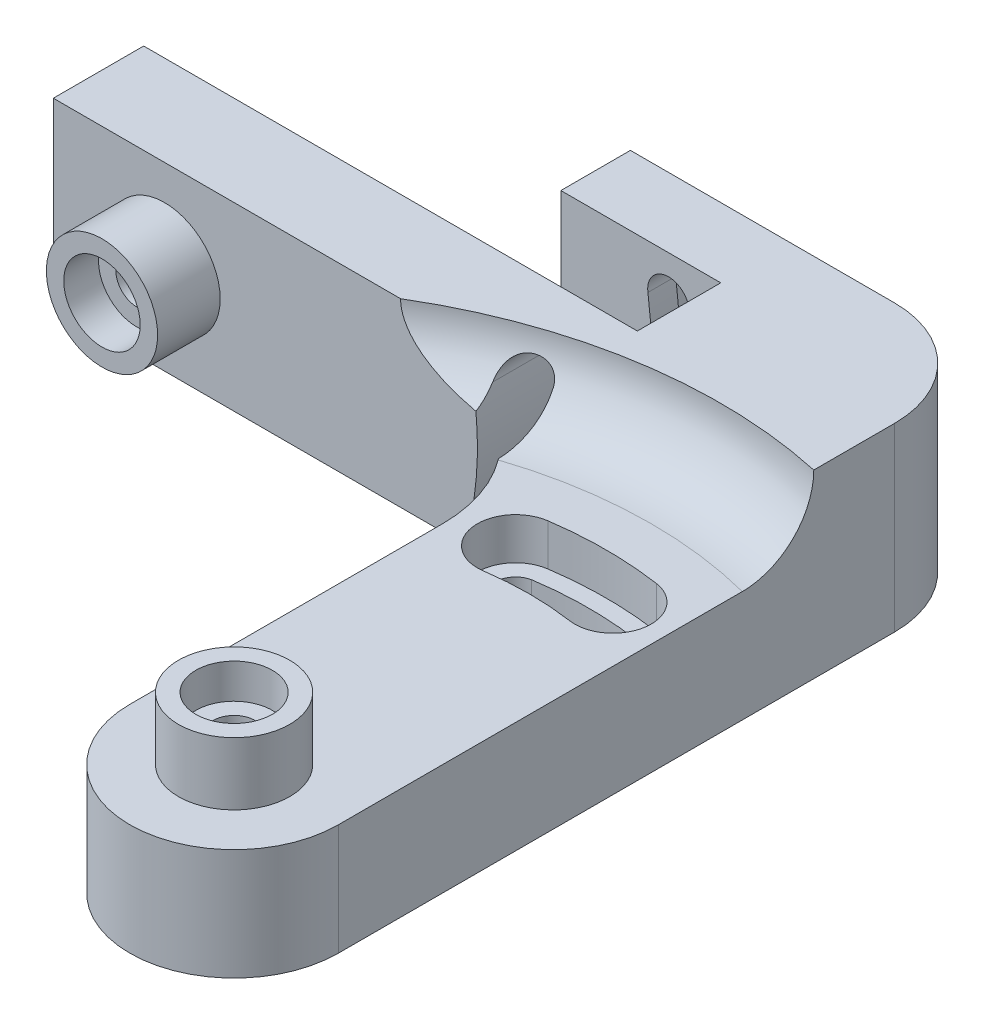
from build123d import *

# Parameters (mm, degrees)
SKETCH1_R           = 1.5
BOSS_EXTRUDE1_DEPTH = 8
SKETCH2_R           = 4
SKETCH2_R_2         = 1.5
BOSS_EXTRUDE2_DEPTH = 2
SKETCH4_R           = 4
SKETCH4_R_2         = 2.75
BOSS_EXTRUDE3_DEPTH = 2.5
CUT_EXTRUDE1_DEPTH  = 3
BOSS_EXTRUDE4_DEPTH = 5
BOSS_EXTRUDE5_DEPTH = 2.5
BOSS_EXTRUDE6_DEPTH = 13
BOSS_EXTRUDE7_DEPTH = 8
CUT_EXTRUDE4_START  = -5
SKETCH16_R          = 35.00000000000001
SKETCH16_R_2        = 33.50186054017001
CUT_EXTRUDE4_DEPTH  = 5
FILLET2_R           = 5
SKETCH6_R           = 1.500000000000004
CUT_EXTRUDE5_DEPTH  = 72.01408318918156
SKETCH6_8_R         = 1.500000000000004
CUT_EXTRUDE6_DEPTH  = 3
SKETCH17_R          = 3.999999999999999
SKETCH17_R_2        = 1.500000000000004
BOSS_EXTRUDE8_DEPTH = 2
SKETCH18_R          = 4.000000000000003
SKETCH18_R_2        = 2.7500000000000018
BOSS_EXTRUDE9_DEPTH = 2.5


with BuildPart() as part:
    # Sketch1 → Boss-Extrude1 (new body)
    with BuildSketch(Plane(origin=(0, 0, 0), x_dir=(1, 0, 0), z_dir=(0, 1, 0))):
        with BuildLine():
            Line((-7.5, 36.50000000000001), (-43, 36.5))
            Line((-43, 36.5), (-43, 32.5))
            Line((-43, 32.5), (-17.500000000000068, 32.49999999999999))
            ThreePointArc((-17.500000000000068, 32.49999999999999), (-10.428932188134521, 29.571067811865472), (-7.499999999999997, 22.499999999999922))
            Line((-7.499999999999997, 22.499999999999922), (-7.5, 0))
            ThreePointArc((-7.5, 0), (-1.38e-15, -7.5), (7.5, 0))
            Line((7.5, 0), (7.5, 40))
            ThreePointArc((7.5, 40), (5.303300858899107, 45.30330085889911), (1.7e-16, 47.5))
            Line((1.7e-16, 47.5), (-19, 47.5))
            Line((-19, 47.5), (-19, 42.5))
            Line((-19, 42.5), (-7.5, 42.5))
            Line((-7.5, 42.5), (-7.5, 36.50000000000001))
        make_face()
        with Locations(Location((0, 0, 0), (0, 0, 270))):
            Circle(SKETCH1_R, mode=Mode.SUBTRACT)
        with BuildLine():
            ThreePointArc((-3.822328563123411, 25.208378945159915), (-4.975312131849936, 23.47239594738329), (-3.2806101420555054, 22.2595508442844))
            ThreePointArc((-3.2806101420555054, 22.2595508442844), (-0.0667184196164731, 22.499901229693076), (3.1485421826830366, 22.278615056087435))
            ThreePointArc((3.1485421826830366, 22.278615056087435), (4.959579589511544, 23.370856111085427), (3.8935926199376825, 25.19747013486111))
            ThreePointArc((3.8935926199376825, 25.19747013486111), (0.03604708010283943, 25.496495157085157), (-3.822328563123411, 25.208378945159915))
        make_face(mode=Mode.SUBTRACT)
    extrude(amount=BOSS_EXTRUDE1_DEPTH)

    # Sketch2 → Boss-Extrude2 (add)
    with BuildSketch(Plane(origin=(0, 8, 0), x_dir=(1, 0, 0), z_dir=(0, 1, 0))):
        with Locations(Location((0, 0, 0), (0, 0, 270))):
            Circle(SKETCH2_R)
        with Locations(Location((0, 0, 0), (0, 0, 270))):
            Circle(SKETCH2_R_2, mode=Mode.SUBTRACT)
    extrude(amount=BOSS_EXTRUDE2_DEPTH)

    # Sketch4 → Boss-Extrude3 (add)
    with BuildSketch(Plane(origin=(0, 10, 0), x_dir=(1, 0, 0), z_dir=(0, 1, 0))):
        with Locations(Location((0, 0, 0), (0, 0, 270))):
            Circle(SKETCH4_R)
        with Locations(Location((0, 0, 0), (0, 0, 270))):
            Circle(SKETCH4_R_2, mode=Mode.SUBTRACT)
    extrude(amount=BOSS_EXTRUDE3_DEPTH)

    # Sketch5 → Cut-Extrude1 (cut)
    with BuildSketch(Plane(origin=(0, 8, 0), x_dir=(1, 0, 0), z_dir=(0, 1, 0))):
        with BuildLine():
            ThreePointArc((-3.901041666666667, 26.46402036567631), (-6.220600224508779, 23.342378474500862), (-3.098958333333334, 21.022819916658754))
            ThreePointArc((-3.098958333333334, 21.022819916658754), (1.3e-15, 21.250000000000004), (3.098958333333334, 21.022819916658754))
            ThreePointArc((3.098958333333334, 21.022819916658754), (6.220600224508775, 23.342378474500865), (3.901041666666667, 26.46402036567631))
            ThreePointArc((3.901041666666667, 26.46402036567631), (1.64e-15, 26.749999999999996), (-3.901041666666667, 26.46402036567631))
        make_face()
    extrude(amount=-CUT_EXTRUDE1_DEPTH, mode=Mode.SUBTRACT)

    # Sketch11 → Boss-Extrude4 (add)
    with BuildSketch(Plane(origin=(0, 8, 0), x_dir=(1, 0, 0), z_dir=(0, 1, 0))):
        with BuildLine():
            Line((-19, 42.5), (-7.5, 42.5))
            Line((-7.5, 42.5), (-7.5, 36.50000000000001))
            Line((-7.5, 36.50000000000001), (-43, 36.5))
            Line((-43, 36.5), (-43, 32.5))
            Line((-43, 32.5), (-17.500000000000064, 32.49999999999999))
            ThreePointArc((-17.500000000000064, 32.49999999999999), (-15.859503936382302, 32.36452090398995), (-14.263458457505935, 31.961754533050943))
            ThreePointArc((-14.263458457505937, 31.961754533050936), (-3.5600570438609966, 34.81847202053036), (7.5, 34.18698582794336))
            Line((7.5, 34.18698582794336), (7.5, 40))
            ThreePointArc((7.5, 40), (5.303300858899107, 45.30330085889911), (1.3e-16, 47.5))
            Line((9.2e-16, 47.5), (-19, 47.5))
            Line((-19, 47.5), (-19, 42.5))
        make_face()
    extrude(amount=BOSS_EXTRUDE4_DEPTH)

    # Sketch12 → Boss-Extrude5 (add)
    with BuildSketch(Plane.XY.offset(-32.499999999999986)):
        Polygon((-43.00000000000001, 0), (-17.500000000000078, 0), (-17.500000000000085, 13.000000000000002), (-43.00000000000001, 13.000000000000002), align=None)
    extrude(amount=BOSS_EXTRUDE5_DEPTH)

    # Sketch14 → Boss-Extrude6 (add)
    with BuildSketch(Plane(origin=(0, 0, 0), x_dir=(1, 0, 0), z_dir=(0, 1, 0))):
        with BuildLine():
            Line((-17.500000000000068, 30.310889132455326), (-17.500000000000075, 32.49999999999999))
            ThreePointArc((-17.500000000000075, 32.49999999999999), (-15.859503936382307, 32.364520903989956), (-14.263458457505932, 31.961754533050946))
            ThreePointArc((-14.263458457505932, 31.961754533050946), (-15.903165170435354, 31.178347255136085), (-17.500000000000068, 30.310889132455326))
        make_face()
    extrude(amount=BOSS_EXTRUDE6_DEPTH)

    # Sketch15 → Boss-Extrude7 (add)
    with BuildSketch(Plane(origin=(0, 0, 0), x_dir=(1, 0, 0), z_dir=(0, 1, 0))):
        with BuildLine():
            Line((-17.500000000000075, 29.99999999999999), (-17.500000000000068, 30.310889132455326))
            ThreePointArc((-17.500000000000068, 30.310889132455326), (-15.90316517043534, 31.178347255136092), (-14.263458457505916, 31.961754533050954))
            ThreePointArc((-14.263458457505916, 31.961754533050954), (-12.477821634213894, 31.14741143130302), (-10.8856217223385, 29.99999999999999))
            Line((-10.8856217223385, 29.99999999999999), (-17.500000000000075, 29.99999999999999))
        make_face()
    extrude(amount=BOSS_EXTRUDE7_DEPTH)

    # Sketch16 → Cut-Extrude4 (cut)
    with BuildSketch(Plane(origin=(0, 13.000000000000002, 0), x_dir=(1, 0, 0), z_dir=(0, 1, 0)).offset(CUT_EXTRUDE4_START)):
        Circle(SKETCH16_R)
        Circle(SKETCH16_R_2, mode=Mode.SUBTRACT)
    extrude(amount=CUT_EXTRUDE4_DEPTH, mode=Mode.SUBTRACT)

    # Fillet2
    fillet2_edges = [part.edges().sort_by_distance(p)[0] for p in [
        (-5.664903014694951, 8, -34.5385129071027),
    ]]
    fillet(fillet2_edges, radius=FILLET2_R - 0.0001)  # a hair under: the kernel refuses the full size

    # Sketch6 → Cut-Extrude5 (cut, through all)
    with BuildSketch(Plane(origin=(0, 0, -47.5), x_dir=(-1, 0, 0), z_dir=(0, 0, -1))):
        with BuildLine():
            ThreePointArc((12.740543617655444, 9.78125), (11.475329858832474, 11.483963758822968), (9.772616100009506, 10.21875))
            ThreePointArc((9.772616100009506, 10.21875), (9.50000000000001, 6.5000000000000036), (9.772616100009508, 2.7812499999999982))
            ThreePointArc((9.772616100009508, 2.7812499999999982), (11.475329858832469, 1.5160362411770363), (12.740543617655444, 3.218749999999997))
            ThreePointArc((12.740543617655444, 3.218749999999997), (12.500000000000004, 6.500000000000003), (12.740543617655444, 9.78125))
        make_face()
        with Locations(Location((35, 6.5, 0), (0, 0, 180))):
            Circle(SKETCH6_R)
    extrude(amount=-CUT_EXTRUDE5_DEPTH, mode=Mode.SUBTRACT)

    # Sketch6<8> → Cut-Extrude6 (cut)
    # profile 1 of 2: a face of its own
    with BuildSketch(Plane(origin=(0, 0, -47.5), x_dir=(-1, 0, 0), z_dir=(0, 0, -1))):
        with Locations(Location((35, 6.5, 0), (0, 0, 180))):
            Circle(SKETCH6_8_R)
    # profile 2 of 2: a face of its own
    with BuildSketch(Plane(origin=(0, 0, -47.5), x_dir=(-1, 0, 0), z_dir=(0, 0, -1))):
        with BuildLine():
            ThreePointArc((13.977180083341253, 9.598958333333332), (11.65762152549914, 12.720600224508777), (8.535979634323695, 10.401041666666664))
            ThreePointArc((8.535979634323695, 10.401041666666664), (8.250000000000007, 6.5000000000000036), (8.535979634323692, 2.5989583333333335))
            ThreePointArc((8.535979634323692, 2.5989583333333335), (11.657621525499136, 0.27939977549122075), (13.97718008334125, 3.401041666666666))
            ThreePointArc((13.97718008334125, 3.401041666666666), (13.750000000000004, 6.500000000000003), (13.977180083341253, 9.598958333333332))
        make_face()
        with BuildLine():
            ThreePointArc((12.740543617655444, 9.78125), (11.475329858832474, 11.483963758822968), (9.772616100009506, 10.21875))
            ThreePointArc((9.772616100009506, 10.21875), (9.50000000000001, 6.5000000000000036), (9.772616100009508, 2.7812499999999982))
            ThreePointArc((9.772616100009508, 2.7812499999999982), (11.475329858832469, 1.5160362411770363), (12.740543617655444, 3.218749999999997))
            ThreePointArc((12.740543617655444, 3.218749999999997), (12.500000000000004, 6.500000000000003), (12.740543617655444, 9.78125))
        make_face(mode=Mode.SUBTRACT)
    extrude(amount=-CUT_EXTRUDE6_DEPTH, mode=Mode.SUBTRACT)

    # Sketch17 → Boss-Extrude8 (add)
    with BuildSketch(Plane.XY.offset(-29.99999999999999)):
        with Locations((-35, 6.5)):
            Circle(SKETCH17_R)
        with Locations((-35, 6.5)):
            Circle(SKETCH17_R_2, mode=Mode.SUBTRACT)
    extrude(amount=BOSS_EXTRUDE8_DEPTH)

    # Sketch18 → Boss-Extrude9 (add)
    with BuildSketch(Plane.XY.offset(-27.99999999999999)):
        with Locations((-35, 6.5)):
            Circle(SKETCH18_R)
        with Locations((-35, 6.5)):
            Circle(SKETCH18_R_2, mode=Mode.SUBTRACT)
    extrude(amount=BOSS_EXTRUDE9_DEPTH)


solid = part.part
